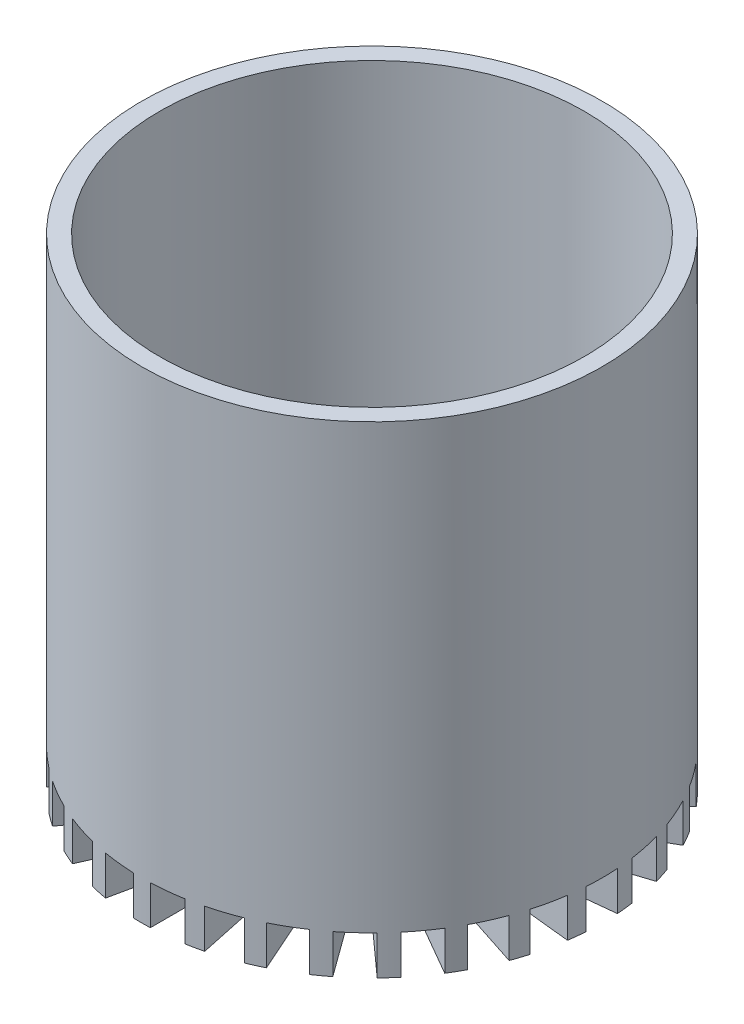
from build123d import *
from build123d.topology import SkipClean

# Parameters (mm, degrees)
SKETCH1_R               = 38.1
BOSS_EXTRUDE1_DEPTH     = 76.2
SHELL2_T                = 3.175
BOSS_EXTRUDE2_DEPTH     = 7
CUT_EXTRUDE1_DEPTH      = 99.527366122
CUT_EXTRUDE1_DEPTH_BACK = 99.527366122
SKETCH3_R               = 61.906276858
SKETCH3_R_2             = 41.275
SKETCH4_R               = 20.64
CUT_EXTRUDE2_DEPTH      = 7
SCALE1_SCALE            = 0.615384615


# Read off the part's stored shape, not the designer's step: Boss-Extrude2
with BuildPart() as part:
    # Sketch1 → Boss-Extrude1 (new body)
    with BuildSketch(Plane(origin=(0, 0, 0), x_dir=(1, 0, 0), z_dir=(0, 1, 0))):
        with Locations(Location((0, 0, 0), (0, 0, 90))):
            Circle(SKETCH1_R)
    extrude(amount=BOSS_EXTRUDE1_DEPTH)

    # Shell2
    shell2_openings = [part.faces().sort_by_distance(p)[0] for p in [
        (0, 76.2, 0),
    ]]
    offset(amount=SHELL2_T, openings=shell2_openings, kind=Kind.INTERSECTION)

    # Boss-Extrude2 outline → Boss-Extrude2 (add)
    with BuildSketch(Plane(origin=(0, -3.175, 0), x_dir=(-1, 0, 0), z_dir=(0, -1, 0))):
        Polygon((1.5, 14.271546681), (1.5, 41.275), (-1.5, 41.275), (-1.5, 14.271546681), (-7.114333637, 40.684909757), (-10.04877644, 40.061174684), (-4.434442802, 13.647811609), (-15.417736756, 38.316693729), (-18.158373129, 37.0964838), (-7.175079175, 12.42760168), (-23.047310797, 34.273854321), (-25.47436178, 32.510498564), (-9.602130158, 10.664245923), (-29.669606762, 28.733083016), (-31.676998581, 26.503648539), (-11.609521977, 8.434811446), (-34.995198541, 21.936538106), (-36.495198541, 19.338461894), (-13.109521977, 5.836735235), (-38.791332219, 14.181261217), (-39.718383202, 11.328091668), (-14.03657296, 2.983565686), (-40.892098536, 5.806195164), (-41.205683926, 2.822629478), (-14.35015835, 0), (-41.205683926, -2.822629478), (-40.892098536, -5.806195164), (-14.03657296, -2.983565686), (-39.718383202, -11.328091668), (-38.791332219, -14.181261217), (-13.109521977, -5.836735235), (-36.495198541, -19.338461894), (-34.995198541, -21.936538106), (-11.609521977, -8.434811446), (-31.676998581, -26.503648539), (-29.669606762, -28.733083016), (-9.602130158, -10.664245923), (-25.47436178, -32.510498564), (-23.047310797, -34.273854321), (-7.175079175, -12.42760168), (-18.158373129, -37.0964838), (-15.417736756, -38.316693729), (-4.434442802, -13.647811609), (-10.04877644, -40.061174684), (-7.114333637, -40.684909757), (-1.5, -14.271546681), (-1.5, -41.275), (1.5, -41.275), (1.5, -14.271546681), (7.114333637, -40.684909757), (10.04877644, -40.061174684), (4.434442802, -13.647811609), (15.417736756, -38.316693729), (18.158373129, -37.0964838), (7.175079175, -12.42760168), (23.047310797, -34.273854321), (25.47436178, -32.510498564), (9.602130158, -10.664245923), (29.669606762, -28.733083016), (31.676998581, -26.503648539), (11.609521977, -8.434811446), (34.995198541, -21.936538106), (36.495198541, -19.338461894), (13.109521977, -5.836735235), (38.791332219, -14.181261217), (39.718383202, -11.328091668), (14.03657296, -2.983565686), (40.892098536, -5.806195164), (41.205683926, -2.822629478), (14.35015835, 0), (41.205683926, 2.822629478), (40.892098536, 5.806195164), (14.03657296, 2.983565686), (39.718383202, 11.328091668), (38.791332219, 14.181261217), (13.109521977, 5.836735235), (36.495198541, 19.338461894), (34.995198541, 21.936538106), (11.609521977, 8.434811446), (31.676998581, 26.503648539), (29.669606762, 28.733083016), (9.602130158, 10.664245923), (25.47436178, 32.510498564), (23.047310797, 34.273854321), (7.175079175, 12.42760168), (18.158373129, 37.0964838), (15.417736756, 38.316693729), (4.434442802, 13.647811609), (10.04877644, 40.061174684), (7.114333637, 40.684909757), align=None)
    extrude(amount=BOSS_EXTRUDE2_DEPTH)

    # Sketch3 → Cut-Extrude1 (cut, two sides: drawn at the far end of the back side and taken through both)
    with SkipClean():  # the faces are left unmerged after this step: merging them gives an invalid solid
        with BuildSketch(Plane.XZ.offset(3.175).offset(-CUT_EXTRUDE1_DEPTH_BACK)):
            Circle(SKETCH3_R)
            with Locations(Location((0, 0, 0), (0, 0, 272.082679548))):
                Circle(SKETCH3_R_2, mode=Mode.SUBTRACT)
        extrude(amount=CUT_EXTRUDE1_DEPTH + CUT_EXTRUDE1_DEPTH_BACK, mode=Mode.SUBTRACT)

    # Sketch4 → Cut-Extrude2 (cut)
    with SkipClean():  # the faces are left unmerged after this step: merging them gives an invalid solid
        with BuildSketch(Plane.XZ.offset(10.175)):
            Circle(SKETCH4_R)
        extrude(amount=-CUT_EXTRUDE2_DEPTH, mode=Mode.SUBTRACT)


with BuildPart() as part_1:
    # Scale1: scaled about (0, 24.187012891, 0)
    add(part.part.scale(SCALE1_SCALE).moved(Location((0, 9.302697266, 0))))


solid = part_1.part
